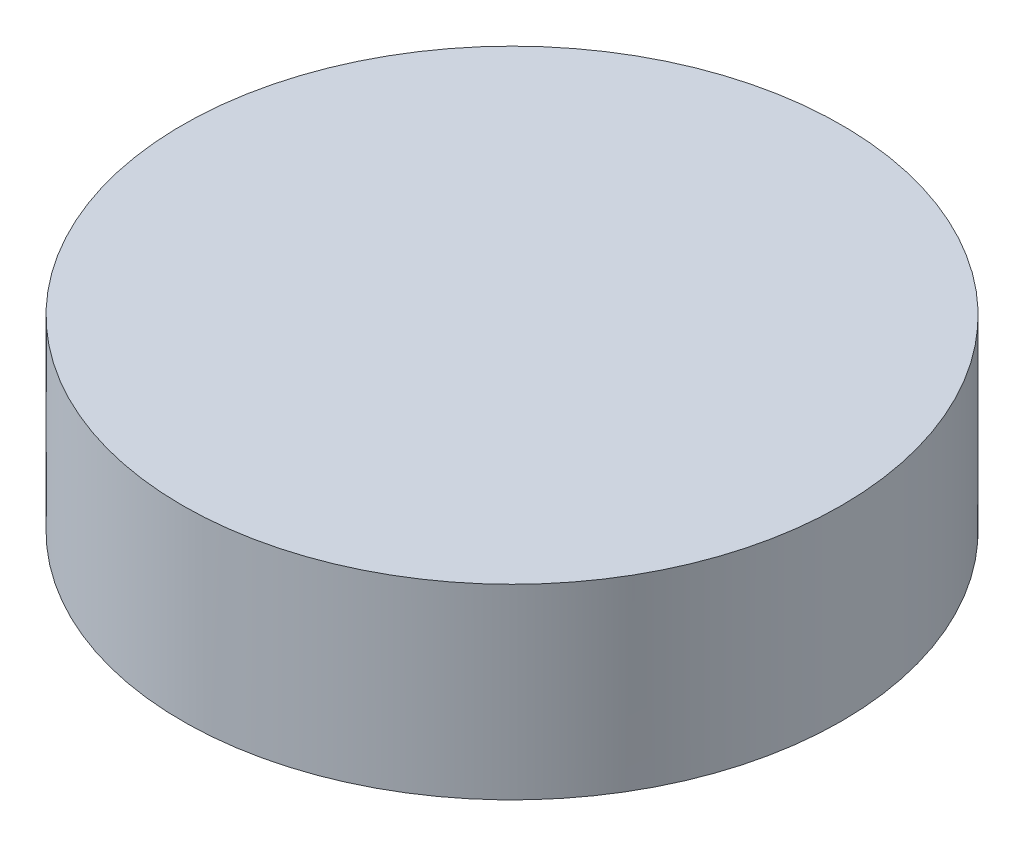
from build123d import *

# Parameters (mm, degrees)
SKETCH1_R           = 15
BOSS_EXTRUDE1_DEPTH = 1
EXTRUDE_THIN1_START = 7.5
SKETCH2_R           = 15
SKETCH2_R_2         = 14
EXTRUDE_THIN1_DEPTH = 7.5
THREAD1_PITCH       = 2


with BuildPart() as part:
    # Sketch1 → Boss-Extrude1 (new body)
    with BuildSketch(Plane(origin=(0, 7.5, 0), x_dir=(1, 0, 0), z_dir=(0, 1, 0))):
        with Locations(Location((0, 0, 0), (0, 0, 270))):
            Circle(SKETCH1_R)
    extrude(amount=BOSS_EXTRUDE1_DEPTH)

    # Sketch2 → Extrude-Thin1 (add)
    with BuildSketch(Plane.XZ.offset(-7.5).offset(EXTRUDE_THIN1_START)):
        Circle(SKETCH2_R)
        Circle(SKETCH2_R_2, mode=Mode.SUBTRACT)
    extrude(amount=-EXTRUDE_THIN1_DEPTH)

    # Thread1: the profile of Thread Profile1 profile screwed along a right-hand helix of 3.25 turns, 10 arcs to a turn; built about Z, then put on its axis
    thread1_z = Axis((0, 0, 0), (0, 0, 1))
    thread1_corners = [(14.0003, 0, -0.000173205), (14.0003, 0, 1.7501732), (12.91746825, 0, 1.124999997), (12.91746825, 0, 0.624999997)]
    with BuildLine(mode=Mode.PRIVATE) as thread1_profile:
        Line(thread1_corners[0], thread1_corners[1])
        Line(thread1_corners[1], thread1_corners[2])
        Line(thread1_corners[2], thread1_corners[3])
        Line(thread1_corners[3], thread1_corners[0])
    thread1_cap = Face(thread1_profile.wire())
    thread1_turn_angles = [0, 18, 36, 54, 72, 90, 108, 126, 144, 162, 180, 198, 216, 234, 252, 270, 288, 306, 324, 342, 360]
    thread1_turn_weights = [1, 0.9510565162951535, 1, 0.9510565162951535, 1, 0.9510565162951535, 1, 0.9510565162951535, 1, 0.9510565162951535, 1, 0.9510565162951535, 1, 0.9510565162951535, 1, 0.9510565162951535, 1, 0.9510565162951535, 1, 0.9510565162951535, 1]
    thread1_turn_rails = [Edge.make_bspline([Vector(p[0], p[1], 0).rotate(thread1_z, thread1_turn_angles[k]) / thread1_turn_weights[k] + Vector(0, 0, p[2] + THREAD1_PITCH * thread1_turn_angles[k] / 360) for k in range(21)], [0, 0, 0, 1, 1, 2, 2, 3, 3, 4, 4, 5, 5, 6, 6, 7, 7, 8, 8, 9, 9, 10, 10, 10], 2, thread1_turn_weights) for p in thread1_corners]
    thread1_turn_sides = [Face.make_surface_from_curves(thread1_turn_rails[p[0]], thread1_turn_rails[p[1]]) for p in [(0, 1), (1, 2), (2, 3), (3, 0)]]
    thread1_last_angles = [1080, 1098, 1116, 1134, 1152, 1161, 1170]
    thread1_last_weights = [1, 0.9510565162951535, 1, 0.9510565162951535, 1, 0.9876883405951378, 1]
    thread1_last_rails = [Edge.make_bspline([Vector(p[0], p[1], 0).rotate(thread1_z, thread1_last_angles[k]) / thread1_last_weights[k] + Vector(0, 0, p[2] + THREAD1_PITCH * thread1_last_angles[k] / 360) for k in range(7)], [0, 0, 0, 1, 1, 2, 2, 3, 3, 3], 2, thread1_last_weights) for p in thread1_corners]
    thread1_last_sides = [Face.make_surface_from_curves(thread1_last_rails[p[0]], thread1_last_rails[p[1]]) for p in [(0, 1), (1, 2), (2, 3), (3, 0)]]
    thread1 = Plane(origin=(0, 0, 0), x_dir=(1, 0, 0), z_dir=(0, 1, 0)) * Solid(Shell([*[p.moved(Location((0, 0, THREAD1_PITCH * i))) for i in range(3) for p in thread1_turn_sides], *thread1_last_sides, thread1_cap, thread1_cap.rotate(thread1_z, 1170).moved(Location((0, 0, THREAD1_PITCH * 1170 / 360)))]))
    add(thread1)


solid = part.part
